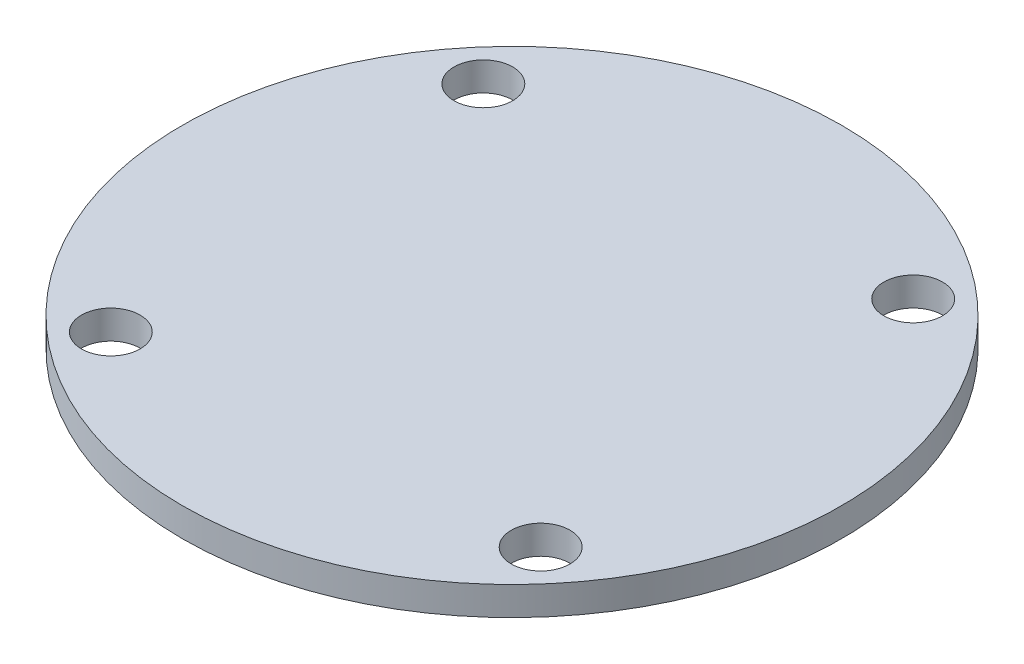
from build123d import *

# Parameters (mm, degrees)
SKETCH1_R           = 29.21
BOSS_EXTRUDE1_DEPTH = 2.54
SKETCH2_R           = 2.6
CUT_EXTRUDE1_DEPTH  = 42.387193671
CIRPATTERN1_COUNT   = 4


with BuildPart() as part:
    # Sketch1 → Boss-Extrude1 (new body)
    with BuildSketch(Plane(origin=(0, 0, 0), x_dir=(1, 0, 0), z_dir=(0, 1, 0))):
        Circle(SKETCH1_R)
    extrude(amount=BOSS_EXTRUDE1_DEPTH)

    # Sketch2 → Cut-Extrude1 (cut, through all)
    with BuildSketch(Plane(origin=(0, 2.54, 0), x_dir=(1, 0, 0), z_dir=(0, 1, 0))):
        with Locations((-16.51, -19.05)):
            Circle(SKETCH2_R)
    cut_extrude1 = extrude(amount=-CUT_EXTRUDE1_DEPTH, mode=Mode.SUBTRACT)

    # CirPattern1: Cut-Extrude1 ×4 about axis
    cirpattern1_axis = Axis((0, 2.54, 0), (0, 1, 0))
    for i in range(1, CIRPATTERN1_COUNT):
        add(cut_extrude1.rotate(cirpattern1_axis, i * 360 / CIRPATTERN1_COUNT), mode=Mode.SUBTRACT)


solid = part.part
